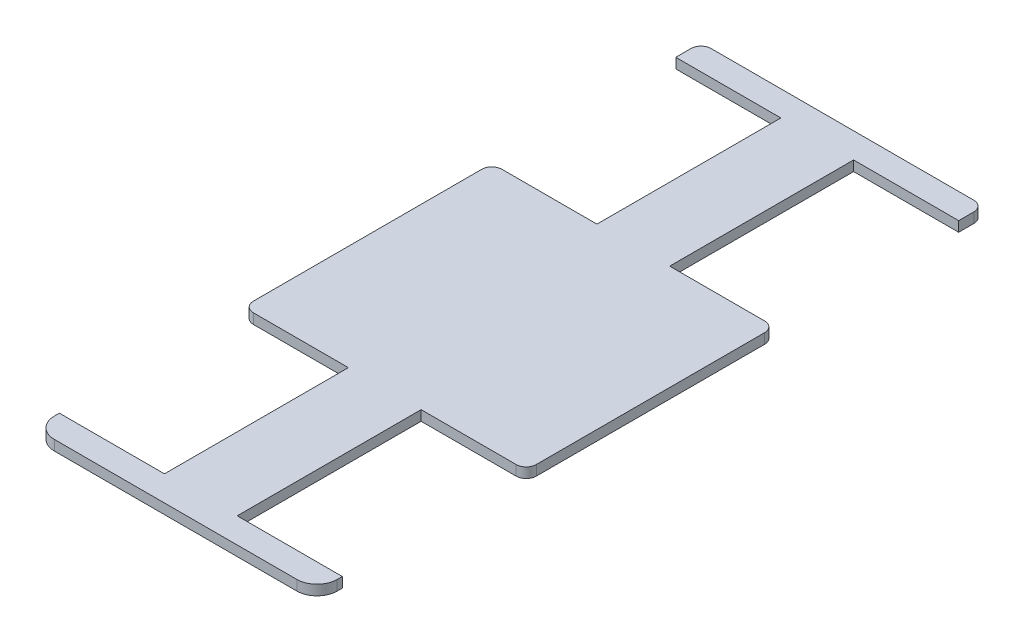
from build123d import *

# Parameters (mm, degrees)
BOSS_EXTRUDE1_DEPTH = 5
FILLET1_R           = 10
FILLET2_R           = 5


with BuildPart() as part:
    # Sketch1 → Boss-Extrude1 (new body)
    with BuildSketch(Plane(origin=(0, 0, 0), x_dir=(1, 0, 0), z_dir=(0, 1, 0))):
        Polygon((0, 0), (140, 0), (140, 12.5), (88, 12.5), (88, 103.5), (140, 103.5), (140, 226.5), (88, 226.5), (88, 317.5), (140, 317.5), (140, 330), (0, 330), (0, 317.5), (52, 317.5), (52, 226.5), (0, 226.5), (0, 103.5), (52, 103.5), (52, 12.5), (0, 12.5), align=None)
    extrude(amount=BOSS_EXTRUDE1_DEPTH)

    # Fillet1
    fillet1_edges = [part.edges().sort_by_distance(p)[0] for p in [
        (140, 2.5, 0),
        (0, 2.5, 0),
    ]]
    fillet(fillet1_edges, radius=FILLET1_R)

    # Fillet2
    fillet2_edges = [part.edges().sort_by_distance(p)[0] for p in [
        (0, 2.5, -330),
        (140, 2.5, -330),
        (140, 2.5, -226.5),
        (0, 2.5, -226.5),
        (140, 2.5, -103.5),
        (0, 2.5, -103.5),
    ]]
    fillet(fillet2_edges, radius=FILLET2_R)


solid = part.part
